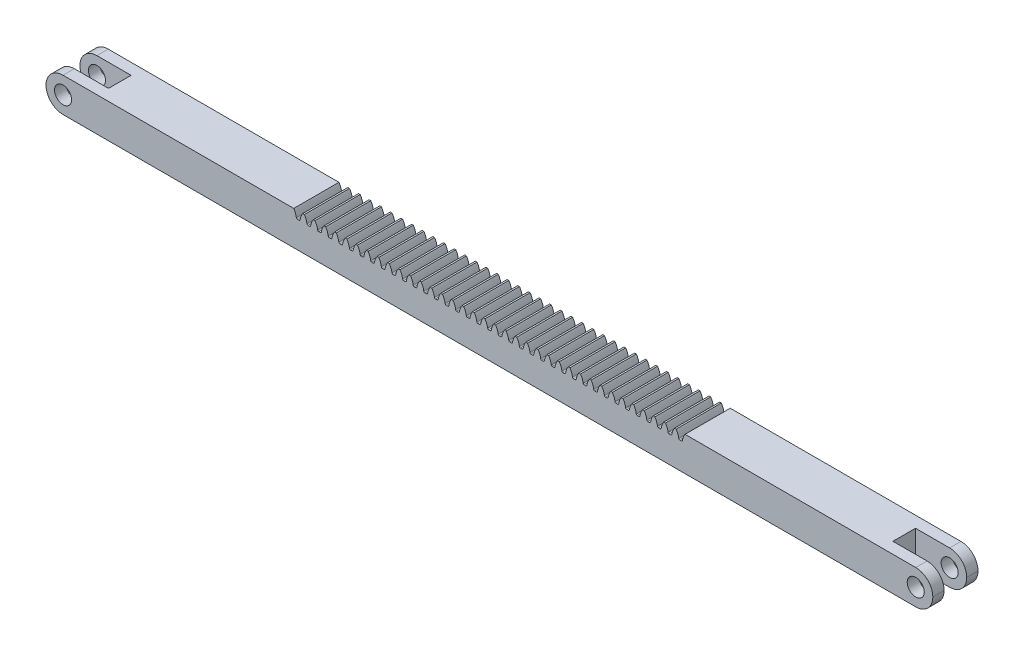
from build123d import *

# Parameters (mm, degrees)
SKETCH1_W              = 520
SKETCH1_H              = 20
SKETCH1_R              = 5
BOSS_EXTRUDE1_DEPTH    = 13.25
FILLET1_R              = 10
CUT_EXTRUDE1_DEPTH     = 262.538238122
FILLET2_R              = 0.594720983
LPATTERN1_COUNT        = 19
LPATTERN1_PITCH        = 6.227903572
FILLET2_OF_LPATTERN1_R = 0.594720983
MIRROR1_START          = -13.25
MIRROR1_DEPTH          = 26.5
SKETCH6_W              = 40
SKETCH6_H              = 13.25
CUT_EXTRUDE2_DEPTH     = 262.104505052


# Read off the part's stored shape, not the designer's step: Mirror1
with BuildPart() as part:
    # Sketch1 → Boss-Extrude1 (new, symmetric)
    with BuildSketch(Plane.XY):
        Rectangle(SKETCH1_W, SKETCH1_H)
        with Locations((-250, 0)):
            Circle(SKETCH1_R, mode=Mode.SUBTRACT)
        with Locations((250, 0)):
            Circle(SKETCH1_R, mode=Mode.SUBTRACT)
    extrude(amount=BOSS_EXTRUDE1_DEPTH, both=True)

    # Fillet1
    fillet1_edges = [part.edges().sort_by_distance(p)[0] for p in [
        (-260, 10, 0),
        (260, -10, 0),
        (260, 10, 0),
        (-260, -10, 0),
    ]]
    fillet(fillet1_edges, radius=FILLET1_R - 0.0001)  # a hair under: the kernel refuses the full size

    # Sketch3 → Cut-Extrude1 (cut, through all)
    with BuildSketch(Plane.XY.offset(13.25)):
        with BuildLine():
            ThreePointArc((1.03805801, 5.504483821), (1.522886946, 7.859982663), (2.620046773, 10))
            Line((2.620046773, 10), (-2.620046773, 10))
            ThreePointArc((-2.620046773, 10), (-1.522886946, 7.859982663), (-1.03805801, 5.504483821))
            ThreePointArc((-1.03805801, 5.504483821), (0, 5.539592626), (1.03805801, 5.504483821))
        make_face()
    cut_extrude1 = extrude(amount=-CUT_EXTRUDE1_DEPTH, mode=Mode.SUBTRACT)

    # Fillet2
    fillet2_edges = [part.edges().sort_by_distance(p)[0] for p in [
        (-1.03805801, 5.504483821, 0),
        (1.03805801, 5.504483821, 0),
    ]]
    fillet(fillet2_edges, radius=FILLET2_R)

    # LPattern1: Cut-Extrude1 ×19
    with Locations(*[(-i * LPATTERN1_PITCH, 0, 0) for i in range(1, LPATTERN1_COUNT)]):
        add(cut_extrude1, mode=Mode.SUBTRACT)

    # Fillet2 of LPattern1
    fillet2_of_lpattern1_edges = [part.edges().sort_by_distance(p)[0] for p in [
        (-7.265961582, 5.504483821, 0),
        (-5.189845563, 5.504483821, 0),
        (-13.493865155, 5.504483821, 0),
        (-11.417749135, 5.504483821, 0),
        (-19.721768727, 5.504483821, 0),
        (-17.645652707, 5.504483821, 0),
        (-25.949672299, 5.504483821, 0),
        (-23.87355628, 5.504483821, 0),
        (-32.177575872, 5.504483821, 0),
        (-30.101459852, 5.504483821, 0),
        (-38.405479444, 5.504483821, 0),
        (-36.329363424, 5.504483821, 0),
        (-44.633383017, 5.504483821, 0),
        (-42.557266997, 5.504483821, 0),
        (-50.861286589, 5.504483821, 0),
        (-48.785170569, 5.504483821, 0),
        (-57.089190161, 5.504483821, 0),
        (-55.013074142, 5.504483821, 0),
        (-63.317093734, 5.504483821, 0),
        (-61.240977714, 5.504483821, 0),
        (-69.544997306, 5.504483821, 0),
        (-67.468881286, 5.504483821, 0),
        (-75.772900879, 5.504483821, 0),
        (-73.696784859, 5.504483821, 0),
        (-82.000804451, 5.504483821, 0),
        (-79.924688431, 5.504483821, 0),
        (-88.228708023, 5.504483821, 0),
        (-86.152592004, 5.504483821, 0),
        (-94.456611596, 5.504483821, 0),
        (-92.380495576, 5.504483821, 0),
        (-100.684515168, 5.504483821, 0),
        (-98.608399148, 5.504483821, 0),
        (-106.912418741, 5.504483821, 0),
        (-104.836302721, 5.504483821, 0),
        (-113.140322313, 5.504483821, 0),
        (-111.064206293, 5.504483821, 0),
    ]]
    fillet(fillet2_of_lpattern1_edges, radius=FILLET2_OF_LPATTERN1_R)

    # Mirror1 outline → Mirror1 (cut)
    with BuildSketch(Plane.XY.offset(MIRROR1_START)):
        with BuildLine():
            ThreePointArc((7.319783958, 6.049826777), (7.845718732, 8.117043629), (8.847950346, 10))
            Line((8.847950346, 10), (3.607856799, 10))
            ThreePointArc((3.607856799, 10), (4.610088413, 8.117043629), (5.136023187, 6.049826777))
            ThreePointArc((5.136023187, 6.049826777), (5.340349377, 5.673503262), (5.74450458, 5.531985943))
            ThreePointArc((5.74450458, 5.531985943), (6.227903572, 5.539592626), (6.711302565, 5.531985943))
            ThreePointArc((6.711302565, 5.531985943), (7.115457768, 5.673503262), (7.319783958, 6.049826777))
        make_face()
        with BuildLine():
            ThreePointArc((13.547687531, 6.049826777), (14.073622304, 8.11704363), (15.075853918, 10))
            Line((15.075853918, 10), (9.835760371, 10))
            ThreePointArc((9.835760371, 10), (10.837991985, 8.117043629), (11.363926759, 6.049826777))
            ThreePointArc((11.363926759, 6.049826777), (11.568252949, 5.673503263), (11.972408152, 5.531985943))
            ThreePointArc((11.972408152, 5.531985943), (12.455807144, 5.539592626), (12.939206137, 5.531985943))
            ThreePointArc((12.939206137, 5.531985943), (13.34336134, 5.673503262), (13.547687531, 6.049826777))
        make_face()
        with BuildLine():
            ThreePointArc((19.775591103, 6.049826777), (20.301525877, 8.117043629), (21.303757491, 10))
            Line((21.303757491, 10), (16.063663944, 10))
            ThreePointArc((16.063663944, 10), (17.065895558, 8.11704363), (17.591830331, 6.049826777))
            ThreePointArc((17.591830331, 6.049826777), (17.796156522, 5.673503262), (18.200311725, 5.531985943))
            ThreePointArc((18.200311725, 5.531985943), (18.683710717, 5.539592626), (19.16710971, 5.531985943))
            ThreePointArc((19.16710971, 5.531985943), (19.571264913, 5.673503263), (19.775591103, 6.049826777))
        make_face()
        with BuildLine():
            ThreePointArc((26.003494675, 6.049826777), (26.529429449, 8.117043629), (27.531661063, 10))
            Line((27.531661063, 10), (22.291567516, 10))
            ThreePointArc((22.291567516, 10), (23.29379913, 8.117043629), (23.819733904, 6.049826777))
            ThreePointArc((23.819733904, 6.049826777), (24.024060094, 5.673503262), (24.428215297, 5.531985943))
            ThreePointArc((24.428215297, 5.531985943), (24.91161429, 5.539592626), (25.395013282, 5.531985943))
            ThreePointArc((25.395013282, 5.531985943), (25.799168485, 5.673503262), (26.003494675, 6.049826777))
        make_face()
        with BuildLine():
            ThreePointArc((32.231398248, 6.049826777), (32.757333021, 8.11704363), (33.759564635, 10))
            Line((33.759564635, 10), (28.519471089, 10))
            ThreePointArc((28.519471089, 10), (29.521702703, 8.11704363), (30.047637476, 6.049826777))
            ThreePointArc((30.047637476, 6.049826777), (30.251963666, 5.673503263), (30.656118869, 5.531985943))
            ThreePointArc((30.656118869, 5.531985943), (31.139517862, 5.539592626), (31.622916855, 5.531985943))
            ThreePointArc((31.622916855, 5.531985943), (32.027072058, 5.673503263), (32.231398248, 6.049826777))
        make_face()
        with BuildLine():
            ThreePointArc((38.45930182, 6.049826777), (38.985236594, 8.117043629), (39.987468208, 10))
            Line((39.987468208, 10), (34.747374661, 10))
            ThreePointArc((34.747374661, 10), (35.749606275, 8.117043629), (36.275541049, 6.049826777))
            ThreePointArc((36.275541049, 6.049826777), (36.479867239, 5.673503262), (36.884022442, 5.531985943))
            ThreePointArc((36.884022442, 5.531985943), (37.367421435, 5.539592626), (37.850820427, 5.531985943))
            ThreePointArc((37.850820427, 5.531985943), (38.25497563, 5.673503262), (38.45930182, 6.049826777))
        make_face()
        with BuildLine():
            ThreePointArc((44.687205393, 6.049826777), (45.213140166, 8.11704363), (46.21537178, 10))
            Line((46.21537178, 10), (40.975278233, 10))
            ThreePointArc((40.975278233, 10), (41.977509847, 8.117043629), (42.503444621, 6.049826777))
            ThreePointArc((42.503444621, 6.049826777), (42.707770811, 5.673503263), (43.111926014, 5.531985943))
            ThreePointArc((43.111926014, 5.531985943), (43.595325006, 5.539592626), (44.078723999, 5.531985943))
            ThreePointArc((44.078723999, 5.531985943), (44.482879202, 5.673503262), (44.687205393, 6.049826777))
        make_face()
        with BuildLine():
            ThreePointArc((50.915108965, 6.049826777), (51.441043739, 8.117043629), (52.443275353, 10))
            Line((52.443275353, 10), (47.203181806, 10))
            ThreePointArc((47.203181806, 10), (48.20541342, 8.11704363), (48.731348193, 6.049826777))
            ThreePointArc((48.731348193, 6.049826777), (48.935674384, 5.673503262), (49.339829587, 5.531985943))
            ThreePointArc((49.339829587, 5.531985943), (49.823228579, 5.539592626), (50.306627572, 5.531985943))
            ThreePointArc((50.306627572, 5.531985943), (50.710782775, 5.673503263), (50.915108965, 6.049826777))
        make_face()
        with BuildLine():
            ThreePointArc((57.143012537, 6.049826777), (57.668947311, 8.117043629), (58.671178925, 10))
            Line((58.671178925, 10), (53.431085378, 10))
            ThreePointArc((53.431085378, 10), (54.433316992, 8.117043629), (54.959251766, 6.049826777))
            ThreePointArc((54.959251766, 6.049826777), (55.163577956, 5.673503262), (55.567733159, 5.531985943))
            ThreePointArc((55.567733159, 5.531985943), (56.051132151, 5.539592626), (56.534531144, 5.531985943))
            ThreePointArc((56.534531144, 5.531985943), (56.938686347, 5.673503262), (57.143012537, 6.049826777))
        make_face()
        with BuildLine():
            ThreePointArc((63.37091611, 6.049826777), (63.896850883, 8.11704363), (64.899082497, 10))
            Line((64.899082497, 10), (59.658988951, 10))
            ThreePointArc((59.658988951, 10), (60.661220565, 8.11704363), (61.187155338, 6.049826777))
            ThreePointArc((61.187155338, 6.049826777), (61.391481528, 5.673503263), (61.795636731, 5.531985943))
            ThreePointArc((61.795636731, 5.531985943), (62.279035724, 5.539592626), (62.762434717, 5.531985943))
            ThreePointArc((62.762434717, 5.531985943), (63.16658992, 5.673503263), (63.37091611, 6.049826777))
        make_face()
        with BuildLine():
            ThreePointArc((69.598819682, 6.049826777), (70.124754456, 8.117043629), (71.12698607, 10))
            Line((71.12698607, 10), (65.886892523, 10))
            ThreePointArc((65.886892523, 10), (66.889124137, 8.117043629), (67.415058911, 6.049826777))
            ThreePointArc((67.415058911, 6.049826777), (67.619385101, 5.673503262), (68.023540304, 5.531985943))
            ThreePointArc((68.023540304, 5.531985943), (68.506939296, 5.539592626), (68.990338289, 5.531985943))
            ThreePointArc((68.990338289, 5.531985943), (69.394493492, 5.673503262), (69.598819682, 6.049826777))
        make_face()
        with BuildLine():
            ThreePointArc((75.826723255, 6.049826777), (76.352658028, 8.11704363), (77.354889642, 10))
            Line((77.354889642, 10), (72.114796095, 10))
            ThreePointArc((72.114796095, 10), (73.117027709, 8.117043629), (73.642962483, 6.049826777))
            ThreePointArc((73.642962483, 6.049826777), (73.847288673, 5.673503263), (74.251443876, 5.531985943))
            ThreePointArc((74.251443876, 5.531985943), (74.734842868, 5.539592626), (75.218241861, 5.531985943))
            ThreePointArc((75.218241861, 5.531985943), (75.622397064, 5.673503262), (75.826723255, 6.049826777))
        make_face()
        with BuildLine():
            ThreePointArc((82.054626827, 6.049826777), (82.580561601, 8.117043629), (83.582793215, 10))
            Line((83.582793215, 10), (78.342699668, 10))
            ThreePointArc((78.342699668, 10), (79.344931282, 8.11704363), (79.870866055, 6.049826777))
            ThreePointArc((79.870866055, 6.049826777), (80.075192246, 5.673503262), (80.479347449, 5.531985943))
            ThreePointArc((80.479347449, 5.531985943), (80.962746442, 5.539592626), (81.446145434, 5.531985943))
            ThreePointArc((81.446145434, 5.531985943), (81.850300637, 5.673503263), (82.054626827, 6.049826777))
        make_face()
        with BuildLine():
            ThreePointArc((88.282530399, 6.049826777), (88.808465173, 8.117043629), (89.810696787, 10))
            Line((89.810696787, 10), (84.57060324, 10))
            ThreePointArc((84.57060324, 10), (85.572834854, 8.117043629), (86.098769628, 6.049826777))
            ThreePointArc((86.098769628, 6.049826777), (86.303095818, 5.673503262), (86.707251021, 5.531985943))
            ThreePointArc((86.707251021, 5.531985943), (87.190650014, 5.539592626), (87.674049006, 5.531985943))
            ThreePointArc((87.674049006, 5.531985943), (88.078204209, 5.673503262), (88.282530399, 6.049826777))
        make_face()
        with BuildLine():
            ThreePointArc((94.510433972, 6.049826777), (95.036368745, 8.11704363), (96.038600359, 10))
            Line((96.038600359, 10), (90.798506813, 10))
            ThreePointArc((90.798506813, 10), (91.800738427, 8.11704363), (92.3266732, 6.049826777))
            ThreePointArc((92.3266732, 6.049826777), (92.53099939, 5.673503263), (92.935154593, 5.531985943))
            ThreePointArc((92.935154593, 5.531985943), (93.418553586, 5.539592626), (93.901952579, 5.531985943))
            ThreePointArc((93.901952579, 5.531985943), (94.306107782, 5.673503263), (94.510433972, 6.049826777))
        make_face()
        with BuildLine():
            ThreePointArc((100.738337544, 6.049826777), (101.264272318, 8.117043629), (102.266503932, 10))
            Line((102.266503932, 10), (97.026410385, 10))
            ThreePointArc((97.026410385, 10), (98.028641999, 8.117043629), (98.554576773, 6.049826777))
            ThreePointArc((98.554576773, 6.049826777), (98.758902963, 5.673503262), (99.163058166, 5.531985943))
            ThreePointArc((99.163058166, 5.531985943), (99.646457158, 5.539592626), (100.129856151, 5.531985943))
            ThreePointArc((100.129856151, 5.531985943), (100.534011354, 5.673503262), (100.738337544, 6.049826777))
        make_face()
        with BuildLine():
            Line((114.722311077, 10), (109.48221753, 10))
            ThreePointArc((109.48221753, 10), (110.484449144, 8.11704363), (111.010383917, 6.049826777))
            ThreePointArc((111.010383917, 6.049826777), (111.214710108, 5.673503262), (111.618865311, 5.531985943))
            ThreePointArc((111.618865311, 5.531985943), (112.102264304, 5.539592626), (112.585663296, 5.531985943))
            ThreePointArc((112.585663296, 5.531985943), (112.989818499, 5.673503263), (113.194144689, 6.049826777))
            ThreePointArc((113.194144689, 6.049826777), (113.720079463, 8.117043629), (114.722311077, 10))
        make_face()
        with BuildLine():
            Line((108.494407504, 10), (103.254313957, 10))
            ThreePointArc((103.254313957, 10), (104.256545571, 8.117043629), (104.782480345, 6.049826777))
            ThreePointArc((104.782480345, 6.049826777), (104.986806535, 5.673503262), (105.390961738, 5.531985943))
            ThreePointArc((105.390961738, 5.531985943), (105.874360731, 5.539592626), (106.357759723, 5.531985943))
            ThreePointArc((106.357759723, 5.531985943), (106.761914926, 5.673503262), (106.966241117, 6.049826777))
            ThreePointArc((106.966241117, 6.049826777), (107.49217589, 8.11704363), (108.494407504, 10))
        make_face()
    extrude(amount=MIRROR1_DEPTH, mode=Mode.SUBTRACT)

    # Sketch6 → Cut-Extrude2 (cut, through all)
    with BuildSketch(Plane(origin=(0, 10, 0), x_dir=(1, 0, 0), z_dir=(0, 1, 0))):
        with Locations((250, 0)):
            Rectangle(SKETCH6_W, SKETCH6_H)
    cut_extrude2 = extrude(amount=-CUT_EXTRUDE2_DEPTH, mode=Mode.SUBTRACT)

    # Mirror2: Cut-Extrude2 across plane
    add(cut_extrude2.mirror(Plane(origin=(0, 0, 0), x_dir=(0, 0, 1), z_dir=(1, 0, 0))), mode=Mode.SUBTRACT)


solid = part.part
